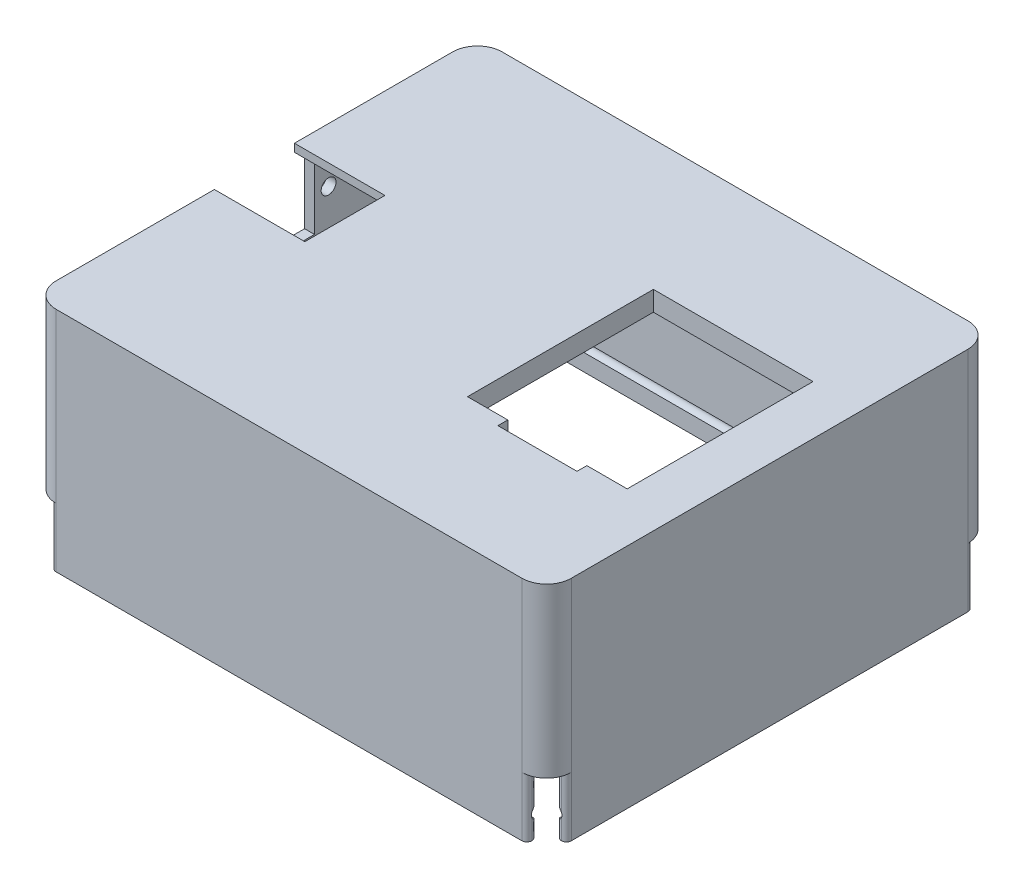
from build123d import *

# Parameters (mm, degrees)
ESQUISSE1_W                  = 104.2
ESQUISSE1_H                  = 90.2
BOSS_EXTRU_1_DEPTH           = 2
ESQUISSE2_W                  = 104.2
ESQUISSE2_H                  = 90.2
ESQUISSE2_W_2                = 100.2
ESQUISSE2_H_2                = 86.2
BOSS_EXTRU_2_DEPTH           = 44
ENL_V_MAT_EXTRU_1_DEPTH      = 12
SYM_TRIE2_COPY_1_DEPTH       = 12
CONG_3_R                     = 1
CONG_1_R                     = 5
ENL_V_MAT_EXTRU_2_DEPTH      = 82.758302331
ENL_V_MAT_EXTRU_3_DEPTH      = 82.758302438
ENL_V_MAT_EXTRU_4_DEPTH      = 122.768838535
ENL_V_MAT_EXTRU_4_DEPTH_BACK = 5
ESQUISSE6_W                  = 20.3
ESQUISSE6_H                  = 14
ESQUISSE7_W                  = 16.2
ESQUISSE7_H                  = 2
ENL_V_MAT_EXTRU_5_DEPTH      = 18.3
ESQUISSE8_W                  = 32.3
ESQUISSE8_H                  = 37.6
ENL_V_MAT_EXTRU_6_DEPTH      = 3
ESQUISSE9_W                  = 44.3
ESQUISSE9_H                  = 49.6
ESQUISSE9_W_2                = 32.3
ESQUISSE9_H_2                = 37.6
BOSS_EXTRU_3_DEPTH           = 2
ESQUISSE10_W                 = 16
ESQUISSE10_H                 = 2
ENL_V_MAT_EXTRU_7_DEPTH      = 83.851795565
ESQUISSE11_W                 = 20
ESQUISSE11_H                 = 20.3
ENL_V_MAT_EXTRU_8_DEPTH      = 0.4
ESQUISSE13_R                 = 0.75
ENL_V_MAT_EXTRU_9_DEPTH      = 3
BOSS_EXTRU_4_DEPTH           = 2
ESQUISSE15_W                 = 100.6
ESQUISSE15_H                 = 86.6
ENL_V_MAT_EXTRU_10_DEPTH     = 4.5
ESQUISSE16_R                 = 1.5
ENL_V_MAT_EXTRU_11_DEPTH     = 4


with BuildPart() as part:
    # Esquisse1 → Boss.-Extru.1 (new body)
    with BuildSketch(Plane(origin=(0, 0, 0), x_dir=(1, 0, 0), z_dir=(0, 1, 0))):
        Rectangle(ESQUISSE1_W, ESQUISSE1_H)
    extrude(amount=BOSS_EXTRU_1_DEPTH)

    # Esquisse2 → Boss.-Extru.2 (add)
    with BuildSketch(Plane.XZ):
        Rectangle(ESQUISSE2_W, ESQUISSE2_H)
        Rectangle(ESQUISSE2_W_2, ESQUISSE2_H_2, mode=Mode.SUBTRACT)
    extrude(amount=BOSS_EXTRU_2_DEPTH)

    # Esquisse3 → Enlèv. mat.-Extru.1 (cut)
    with BuildSketch(Plane.XZ.offset(44)):
        Polygon((-50.1, 41.1), (-50.1, 43.1), (-48.1, 43.1), (-48.1, 45.1), (-52.1, 45.1), (-52.1, 41.1), align=None)
    enl_v_mat_extru_1 = extrude(amount=-ENL_V_MAT_EXTRU_1_DEPTH, mode=Mode.SUBTRACT)

    # Symétrie1: Enlèv. mat.-Extru.1 across plane
    add(enl_v_mat_extru_1.mirror(Plane.XY), mode=Mode.SUBTRACT)

    # Symétrie2: Enlèv. mat.-Extru.1 across plane
    add(enl_v_mat_extru_1.mirror(Plane(origin=(0, 0, 0), x_dir=(0, 0, 1), z_dir=(1, 0, 0))), mode=Mode.SUBTRACT)

    # Symétrie2 copy 1 sketch → Symétrie2 copy 1 (cut)
    with BuildSketch(Plane(origin=(0, -44, 0), x_dir=(-1, 0, 0), z_dir=(0, -1, 0))):
        Polygon((-50.1, 41.1), (-50.1, 43.1), (-48.1, 43.1), (-48.1, 45.1), (-52.1, 45.1), (-52.1, 41.1), align=None)
    extrude(amount=-SYM_TRIE2_COPY_1_DEPTH, mode=Mode.SUBTRACT)

    # Congé3
    cong_3_edges = [part.edges().sort_by_distance(p)[0] for p in [
        (-48.1, -38, 45.1),
        (-48.1, -38, 43.1),
        (-50.1, -38, 41.1),
        (-52.1, -38, 41.1),
        (48.1, -38, 45.1),
        (48.1, -38, 43.1),
        (52.1, -38, 41.1),
        (50.1, -38, 41.1),
        (52.1, -38, -41.1),
        (50.1, -38, -41.1),
        (48.1, -38, -43.1),
        (48.1, -38, -45.1),
        (-48.1, -38, -45.1),
        (-48.1, -38, -43.1),
        (-50.1, -38, -41.1),
        (-52.1, -38, -41.1),
    ]]
    fillet(cong_3_edges, radius=CONG_3_R - 0.0001)  # a hair under: the kernel refuses the full size

    # Congé1
    cong_1_edges = [part.edges().sort_by_distance(p)[0] for p in [
        (52.1, -15, 45.1),
        (52.1, -15, -45.1),
        (-52.1, -15, -45.1),
        (-52.1, -15, 45.1),
    ]]
    fillet(cong_1_edges, radius=CONG_1_R)

    # Esquisse4 → Enlèv. mat.-Extru.2 (cut, symmetric)
    with BuildSketch(Plane(origin=(0, 0, 0), x_dir=(0, 0, -1), z_dir=(1, 0, 0))):
        with BuildLine():
            Line((-43.1, -38.4), (-43.1, -40.6))
            ThreePointArc((-43.1, -40.6), (-44.2, -39.5), (-43.1, -38.4))
        make_face()
    enl_v_mat_extru_2 = extrude(amount=ENL_V_MAT_EXTRU_2_DEPTH, both=True, mode=Mode.SUBTRACT)

    # Symétrie4: Enlèv. mat.-Extru.2 across plane
    add(enl_v_mat_extru_2.mirror(Plane.XY), mode=Mode.SUBTRACT)

    # Esquisse5 → Enlèv. mat.-Extru.3 (cut, symmetric)
    with BuildSketch(Plane.XY):
        with BuildLine():
            Line((-50.1, -38.4), (-50.1, -40.6))
            ThreePointArc((-50.1, -40.6), (-51.2, -39.5), (-50.1, -38.4))
        make_face()
    enl_v_mat_extru_3 = extrude(amount=ENL_V_MAT_EXTRU_3_DEPTH, both=True, mode=Mode.SUBTRACT)

    # Symétrie5: Enlèv. mat.-Extru.3 across plane
    add(enl_v_mat_extru_3.mirror(Plane(origin=(0, 0, 0), x_dir=(0, 0, 1), z_dir=(1, 0, 0))), mode=Mode.SUBTRACT)

    # Esquisse6 → Enlèv. mat.-Extru.4 (cut, two sides: drawn at the far end of the back side and taken through both)
    with BuildSketch(Plane.ZY.offset(52.1).offset(-ENL_V_MAT_EXTRU_4_DEPTH_BACK)):
        with Locations((0, -7)):
            Rectangle(ESQUISSE6_W, ESQUISSE6_H)
    extrude(amount=ENL_V_MAT_EXTRU_4_DEPTH + ENL_V_MAT_EXTRU_4_DEPTH_BACK, mode=Mode.SUBTRACT)

    # Esquisse7 → Enlèv. mat.-Extru.5 (cut)
    with BuildSketch(Plane.ZY.offset(52.1)):
        with Locations((0, 1)):
            Rectangle(ESQUISSE7_W, ESQUISSE7_H)
    extrude(amount=-ENL_V_MAT_EXTRU_5_DEPTH, mode=Mode.SUBTRACT)

    # Esquisse8 → Enlèv. mat.-Extru.6 (cut)
    with BuildSketch(Plane(origin=(0, 2, 0), x_dir=(1, 0, 0), z_dir=(0, 1, 0))):
        with Locations((25.95, 0)):
            Rectangle(ESQUISSE8_W, ESQUISSE8_H)
    extrude(amount=-ENL_V_MAT_EXTRU_6_DEPTH, mode=Mode.SUBTRACT)

    # Esquisse9 → Boss.-Extru.3 (add)
    with BuildSketch(Plane.XZ):
        with Locations((25.95, 0)):
            Rectangle(ESQUISSE9_W, ESQUISSE9_H)
        with Locations((25.95, 0)):
            Rectangle(ESQUISSE9_W_2, ESQUISSE9_H_2, mode=Mode.SUBTRACT)
    extrude(amount=BOSS_EXTRU_3_DEPTH)

    # Esquisse10 → Enlèv. mat.-Extru.7 (cut, through all)
    with BuildSketch(Plane(origin=(0, 2, 0), x_dir=(1, 0, 0), z_dir=(0, 1, 0))):
        with Locations((25.95, -19.8)):
            Rectangle(ESQUISSE10_W, ESQUISSE10_H)
    extrude(amount=-ENL_V_MAT_EXTRU_7_DEPTH, mode=Mode.SUBTRACT)

    # Esquisse11 → Enlèv. mat.-Extru.8 (cut)
    with BuildSketch(Plane(origin=(0, 0, 0), x_dir=(1, 0, 0), z_dir=(0, 1, 0))):
        with Locations((-42.1, 0)):
            Rectangle(ESQUISSE11_W, ESQUISSE11_H)
    extrude(amount=ENL_V_MAT_EXTRU_8_DEPTH, mode=Mode.SUBTRACT)

    # Esquisse13 → Enlèv. mat.-Extru.9 (cut)
    with BuildSketch(Plane.XZ.offset(2)):
        with Locations(Location((45.3, -10.8, 0), (0, 0, 270))):
            Circle(ESQUISSE13_R)
        with Locations(Location((5.2, 9.2, 0), (0, 0, 270))):
            Circle(ESQUISSE13_R)
        with Locations(Location((15.6, -21.4, 0), (0, 0, 270))):
            Circle(ESQUISSE13_R)
    extrude(amount=-ENL_V_MAT_EXTRU_9_DEPTH, mode=Mode.SUBTRACT)

    # Esquisse14 → Boss.-Extru.4 (add)
    with BuildSketch(Plane.XZ.offset(2)):
        with BuildLine():
            Line((3.8, 11.39089023), (3.8, 7.00910977))
            ThreePointArc((3.8, 7.00910977), (2.6, 9.2), (3.8, 11.39089023))
        make_face()
    extrude(amount=-BOSS_EXTRU_4_DEPTH)

    # Esquisse15 → Enlèv. mat.-Extru.10 (cut)
    with BuildSketch(Plane.XZ.offset(44)):
        Rectangle(ESQUISSE15_W, ESQUISSE15_H)
    extrude(amount=-ENL_V_MAT_EXTRU_10_DEPTH, mode=Mode.SUBTRACT)

    # Esquisse16 → Enlèv. mat.-Extru.11 (cut)
    with BuildSketch(Plane.ZY.offset(52.1)):
        with Locations((-13, -7)):
            Circle(ESQUISSE16_R)
    enl_v_mat_extru_11 = extrude(amount=-ENL_V_MAT_EXTRU_11_DEPTH, mode=Mode.SUBTRACT)

    # Symétrie6: Enlèv. mat.-Extru.11 across plane
    add(enl_v_mat_extru_11.mirror(Plane.XY), mode=Mode.SUBTRACT)


solid = part.part
